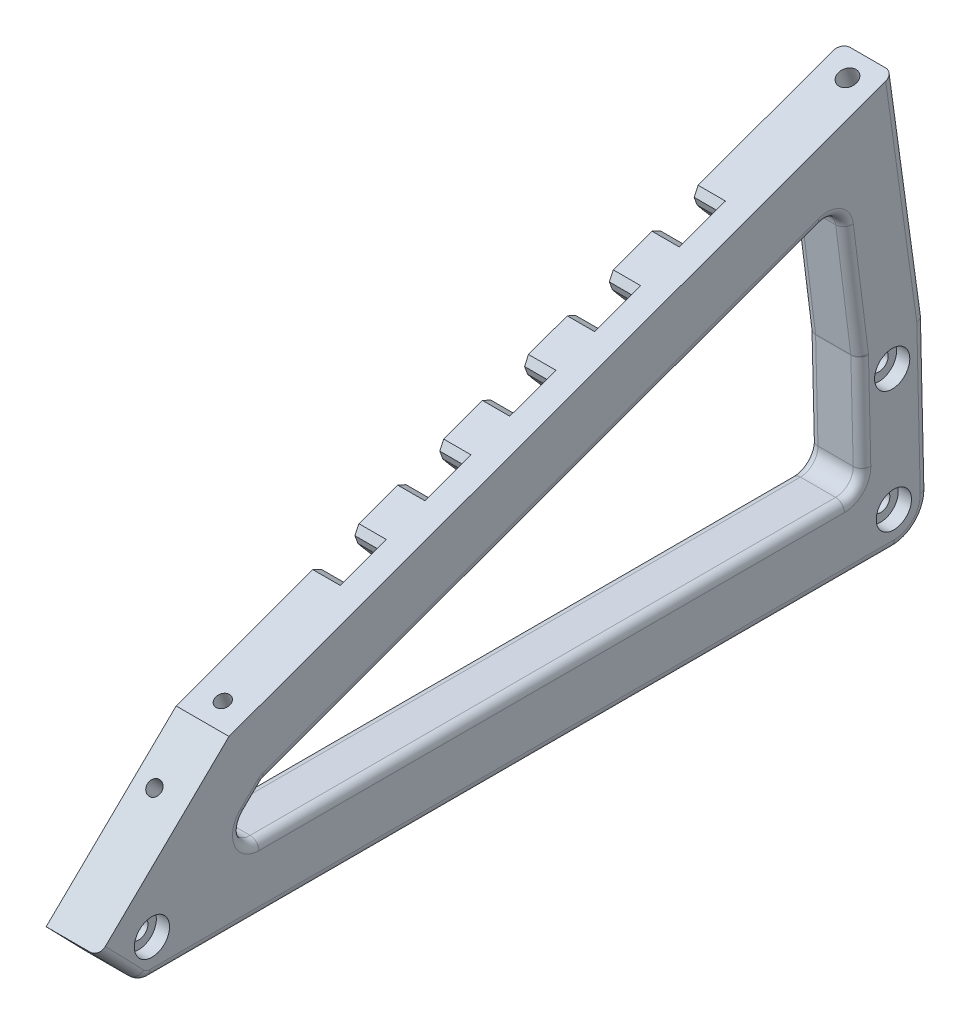
from build123d import *

# Parameters (mm, degrees)
SKETCH1_R               = 2.1
BOSS_EXTRUDE1_DEPTH     = 12
SKETCH2_R               = 1.6
SKETCH2_R_2             = 1.4
CUT_EXTRUDE1_DEPTH      = 12
SKETCH3_R               = 4
CUT_EXTRUDE2_DEPTH      = 3
SKETCH4_R               = 1.6
CUT_EXTRUDE4_DEPTH      = 19
SKETCH7_W               = 6.215759277
SKETCH7_H               = 8.138549633
CUT_EXTRUDE5_DEPTH      = 3.5
LPATTERN1_COUNT         = 5
LPATTERN1_PITCH         = 20.5
CHAMFER2_SIZE           = 1.5
FILLET1_R               = 2
FILLET2_R               = 2
SKETCH18_R              = 5.3
CUT_EXTRUDE10_DEPTH     = 1
CUT_EXTRUDE7_DEPTH      = 6
CUT_EXTRUDE7_DEPTH_BACK = 3
SKETCH13_R              = 3.1
CUT_EXTRUDE8_DEPTH      = 9
CUT_EXTRUDE8_DRAFT      = -1.5
SKETCH15_R              = 2.05
CUT_EXTRUDE9_DEPTH      = 5


with BuildPart() as part:
    # Sketch1 → Boss-Extrude1 (new body)
    with BuildSketch(Plane(origin=(0, 0, 0), x_dir=(0, 0, -1), z_dir=(1, 0, 0))):
        with BuildLine():
            Line((-80.764356581, 24.012047683), (70.342296986, 79.010371781))
            Line((70.342296986, 79.010371781), (77.475739843, 27.555189639))
            Line((77.475739843, 27.555189639), (78.259876122, -6.675276303))
            ThreePointArc((78.259876122, -6.675276303), (75.98323725, -12.450192398), (70.261974321, -14.858488677))
            Line((70.261974321, -14.858488677), (-98.699643506, -14.858488677))
            ThreePointArc((-98.699643506, -14.858488677), (-100.257936009, -14.542470826), (-101.570004389, -13.644350914))
            Line((-101.570004389, -13.644350914), (-110.297725107, -4.651907634))
            Line((-110.297725107, -4.651907634), (-80.764356581, 24.012047683))
        make_face()
        with Locations((-98.266405981, -6.675276303)):
            Circle(SKETCH1_R, mode=Mode.SUBTRACT)
        with Locations((70.261974321, -6.858488677)):
            Circle(SKETCH1_R, mode=Mode.SUBTRACT)
        with Locations((69.886409545, 21.014527834)):
            Circle(SKETCH1_R, mode=Mode.SUBTRACT)
        with BuildLine():
            Line((-72.418480279, 11.087031648), (53.732828795, 57.002353165))
            ThreePointArc((53.732828795, 57.002353165), (57.186228005, 56.657004159), (59.069743036, 53.741939293))
            Line((59.069743036, 53.741939293), (62.491983944, 26.487750987))
            ThreePointArc((62.491983944, 26.487750987), (62.497003485, 26.437568826), (62.499486631, 26.387197416))
            Line((62.499486631, 26.387197416), (63.032017641, 4.237653648))
            ThreePointArc((63.032017641, 4.237653648), (61.895389964, 1.347282386), (59.033173226, 0.141511323))
            Line((59.033173226, 0.141511323), (-73.956988486, 0.141511323))
            ThreePointArc((-73.956988486, 0.141511323), (-77.663836441, 2.63842176), (-76.742850722, 7.011872206))
            Line((-76.742850722, 7.011872206), (-72.772925695, 10.864929248))
            ThreePointArc((-72.772925695, 10.864929248), (-72.607445548, 10.994719988), (-72.418480279, 11.087031648))
        make_face(mode=Mode.SUBTRACT)
    extrude(amount=BOSS_EXTRUDE1_DEPTH)

    # Sketch2 → Cut-Extrude1 (cut)
    with BuildSketch(Plane(origin=(0, 47.160335546, 17.164958377), x_dir=(1, 0, 0), z_dir=(0, 0.9396926207859057, 0.3420201433256765))):
        with Locations(Location((6, -62.781065912, 0), (0, 0, 270))):
            Circle(SKETCH2_R)
        with Locations(Location((6, 88.222046544, 0), (0, 0, 270))):
            Circle(SKETCH2_R_2)
    extrude(amount=-CUT_EXTRUDE1_DEPTH, mode=Mode.SUBTRACT)

    # Sketch3 → Cut-Extrude2 (cut)
    with BuildSketch(Plane(origin=(12, 0, 0), x_dir=(0, 0, -1), z_dir=(1, 0, 0))):
        with Locations((-98.266405981, -6.675276303)):
            Circle(SKETCH3_R)
        with Locations((70.261974321, -6.858488677)):
            Circle(SKETCH3_R)
        with Locations((69.886409545, 21.014527834)):
            Circle(SKETCH3_R)
    extrude(amount=-CUT_EXTRUDE2_DEPTH, mode=Mode.SUBTRACT)

    # Sketch4 → Cut-Extrude4 (cut)
    with BuildSketch(Plane(origin=(0, 52.72881887, 51.176570214), x_dir=(1, 0, 0), z_dir=(0, 0.7175902207560236, 0.6964655591451175))):
        with Locations(Location((4.5, -54.38846236, 0), (0, 0, 270))):
            Circle(SKETCH4_R)
    extrude(amount=-CUT_EXTRUDE4_DEPTH, mode=Mode.SUBTRACT)

    # Sketch7 → Cut-Extrude5 (cut)
    with BuildSketch(Plane(origin=(0, 47.160335546, 17.164958377), x_dir=(1, 0, 0), z_dir=(0, 0.9396926207859057, 0.34202014332567654))):
        with Locations((3.107879639, -29.077947848)):
            Rectangle(SKETCH7_W, SKETCH7_H)
        with Locations((3.107879639, -8.577947848)):
            Rectangle(SKETCH7_W, SKETCH7_H)
        with Locations((3.107879639, 11.922052153)):
            Rectangle(SKETCH7_W, SKETCH7_H)
        with Locations((3.107879639, 32.422052153)):
            Rectangle(SKETCH7_W, SKETCH7_H)
        with Locations((3.107879639, 52.922052153)):
            Rectangle(SKETCH7_W, SKETCH7_H)
    extrude(amount=-CUT_EXTRUDE5_DEPTH, mode=Mode.SUBTRACT)

    # Cut-Loft3: read off the stored shape, not the designer's step
    # Cut-Loft3: loft between two sections, ruled curve by curve
    cut_loft3_from = [
        Edge.make_bspline([(-2.232092873, 55.508495798, -43.78088061), (-2.544400917, 55.590075483, -44.005018953), (-2.880117448, 55.633872158, -44.12534933), (-3.552323761, 55.633872158, -44.12534933), (-3.888040292, 55.590075483, -44.005018953), (-4.200348336, 55.508495798, -43.78088061)], [0, 0, 0, 0, 0.5, 0.5, 1, 1, 1, 1], 3),
        Edge.make_bspline([(-2.232092873, 50.531412034, -30.106455355), (-1.989168835, 50.594867545, -30.280797939), (-1.73353162, 50.687517245, -30.535350896), (-1.227030386, 50.951449132, -31.260497796), (-0.976304902, 51.123342888, -31.732772011), (-0.532384155, 51.552515043, -32.911912816), (-0.340189811, 51.81022676, -33.619969937), (-0.073355372, 52.385448659, -35.200379116), (0, 52.702373125, -36.071121931), (0, 53.337534707, -37.816214034), (-0.073355372, 53.654459173, -38.686956849), (-0.340189811, 54.229681072, -40.267366028), (-0.532384155, 54.487392788, -40.975423149), (-0.976304902, 54.916564943, -42.154563954), (-1.227030386, 55.0884587, -42.626838169), (-1.73353162, 55.352390587, -43.351985069), (-1.989168835, 55.445040286, -43.606538025), (-2.232092873, 55.508495798, -43.78088061)], [0, 0, 0, 0, 0.125, 0.125, 0.25, 0.25, 0.375, 0.375, 0.5, 0.5, 0.625, 0.625, 0.75, 0.75, 0.875, 0.875, 1, 1, 1, 1], 3),
        Edge.make_bspline([(-4.200348336, 50.531412034, -30.106455355), (-3.888040292, 50.449832349, -29.882317012), (-3.552323761, 50.406035673, -29.761986635), (-2.880117448, 50.406035673, -29.761986635), (-2.544400917, 50.449832349, -29.882317012), (-2.232092873, 50.531412034, -30.106455355)], [0, 0, 0, 0, 0.5, 0.5, 1, 1, 1, 1], 3),
        Edge.make_line((-4.200348336, 50.531412034, -30.106455355), (-4.200348336, 55.508495798, -43.78088061)),
    ]
    cut_loft3_to = [
        Edge.make_bspline([(6.215759277, 63.363593192, -37.586441526), (5.179799398, 63.363593192, -37.586441526), (4.143839518, 63.363593192, -37.586441526), (2.071919759, 63.363593192, -37.586441526), (1.03595988, 63.363593192, -37.586441526), (0, 63.363593192, -37.586441526)], [0, 0, 0, 0, 0.5, 0.5, 1, 1, 1, 1], 3),
        Edge.make_bspline([(6.215759277, 60.58004528, -29.938706492), (6.215759277, 60.696026443, -30.257362119), (6.215759277, 60.812007606, -30.576017745), (6.215759277, 61.043969932, -31.213328998), (6.215759277, 61.159951095, -31.531984624), (6.215759277, 61.391913421, -32.169295877), (6.215759277, 61.507894584, -32.487951504), (6.215759277, 61.73985691, -33.125262756), (6.215759277, 61.855838073, -33.443918383), (6.215759277, 62.087800399, -34.081229636), (6.215759277, 62.203781562, -34.399885262), (6.215759277, 62.435743888, -35.037196515), (6.215759277, 62.551725051, -35.355852141), (6.215759277, 62.783687377, -35.993163394), (6.215759277, 62.89966854, -36.31181902), (6.215759277, 63.131630866, -36.949130273), (6.215759277, 63.247612029, -37.2677859), (6.215759277, 63.363593192, -37.586441526)], [0, 0, 0, 0, 0.125, 0.125, 0.25, 0.25, 0.375, 0.375, 0.5, 0.5, 0.625, 0.625, 0.75, 0.75, 0.875, 0.875, 1, 1, 1, 1], 3),
        Edge.make_bspline([(0, 60.58004528, -29.938706492), (1.03595988, 60.58004528, -29.938706492), (2.071919759, 60.58004528, -29.938706492), (4.143839518, 60.58004528, -29.938706492), (5.179799398, 60.58004528, -29.938706492), (6.215759277, 60.58004528, -29.938706492)], [0, 0, 0, 0, 0.5, 0.5, 1, 1, 1, 1], 3),
        Edge.make_line((0, 60.58004528, -29.938706492), (0, 63.363593192, -37.586441526)),
    ]
    cut_loft3 = Solid(Shell([*[Face.make_surface_from_curves(cut_loft3_from[k], cut_loft3_to[k]) for k in range(4)], Face(Wire(cut_loft3_from)), Face(Wire(cut_loft3_to))]))
    add(cut_loft3, mode=Mode.SUBTRACT)

    # LPattern1: Cut-Loft3 ×5
    with Locations(*[Vector(0, -0.34202014332567654, 0.9396926207859057) * (i * LPATTERN1_PITCH) for i in range(1, LPATTERN1_COUNT)]):
        add(cut_loft3, mode=Mode.SUBTRACT)

    # Chamfer2
    chamfer2_edges = [part.edges().sort_by_distance(p)[0] for p in [
        (3.107879639, 38.606865612, 40.66542388),
        (3.107879639, 35.8233177, 48.313158914),
        (3.107879639, 45.61827855, 21.401725154),
        (3.107879639, 42.834730638, 29.049460188),
        (3.107879639, 52.629691488, 2.138026428),
        (3.107879639, 49.846143576, 9.785761462),
        (3.107879639, 59.641104426, -17.125672298),
        (3.107879639, 56.857556514, -9.477937265),
        (3.107879639, 66.652517364, -36.389371024),
        (3.107879639, 63.868969453, -28.741635991),
    ]]
    chamfer(chamfer2_edges, length=CHAMFER2_SIZE)

    # Fillet1
    fillet1_edges = [part.edges().sort_by_distance(p)[0] for p in [
        (12, 10.994719988, 72.607445548),
        (12, 34.044692407, 9.342825742),
        (12, -12.450192398, -75.98323725),
        (12, 10.439956668, -77.867807983),
        (0, 34.044692407, 9.342825742),
        (0, 10.994719988, 72.607445548),
        (12, 53.28278071, -73.909018415),
        (0, 8.938400727, 74.757888209),
        (0, 2.63842176, 77.663836441),
        (0, 0.141511323, 7.46190763),
        (0, 1.347282386, -61.895389964),
        (0, 15.312425532, -62.765752136),
        (0, 26.437568826, -62.497003485),
        (0, 40.11484514, -60.78086349),
        (0, 56.657004159, -57.186228005),
        (12, -9.148129274, 105.933864748),
        (12, -14.542470826, 100.257936009),
        (12, -14.858488677, 14.218834592),
        (12, 56.657004159, -57.186228005),
        (12, 40.11484514, -60.78086349),
        (12, 26.437568826, -62.497003485),
        (12, 15.312425532, -62.765752136),
        (12, 1.347282386, -61.895389964),
        (12, 0.141511323, 7.46190763),
        (12, 2.63842176, 77.663836441),
        (12, 8.938400727, 74.757888209),
    ]]
    fillet(fillet1_edges, radius=FILLET1_R - 0.0001)  # a hair under: the kernel refuses the full size

    # Fillet2
    # the kernel refuses this fillet: 2 mm, written as the material it takes off along each edge
    with BuildSketch(Plane(origin=(0, -6.858488677, -70.261974321), x_dir=(0, 0.02290154687134815, -0.9997377251814095), z_dir=(0, 0.9997377251814095, 0.02290154687134815))) as fillet2_piece_1:
        with BuildLine():
            CenterArc((8 - FILLET2_R, -FILLET2_R), FILLET2_R, 0, 90)
            Line((8, -FILLET2_R), (8, 0))
            Line((8, 0), (8 - FILLET2_R, 0))
        make_face()
    revolve(axis=Axis((0, -6.858488677, -70.261974321), (-1, 0, 0)), revolution_arc=91.312276708, mode=Mode.SUBTRACT)
    with BuildSketch(Plane(origin=(0, 52.548632768, -76.903201171), x_dir=(0, -0.022901546871347135, 0.9997377251814095), z_dir=(0, -0.9997377251814096, -0.022901546871347135))) as fillet2_piece_2:
        with BuildLine():
            CenterArc((FILLET2_R, -FILLET2_R), FILLET2_R, 90, 90)
            Line((0, -FILLET2_R), (0, 0))
            Line((0, 0), (FILLET2_R, 0))
        make_face()
    extrude(amount=59.239446086, mode=Mode.SUBTRACT)
    with BuildSketch(Plane(origin=(0, 83.963004936, -69.655693147), x_dir=(1, 0, 0), z_dir=(0, -0.9905266310012473, -0.13732076782962976))) as fillet2_piece_3:
        with BuildLine():
            CenterArc((FILLET2_R, FILLET2_R), FILLET2_R, 180, 90)
            Line((0, FILLET2_R), (0, 0))
            Line((0, 0), (FILLET2_R, 0))
        make_face()
    extrude(amount=81.947298065, mode=Mode.SUBTRACT)
    with BuildSketch(Plane(origin=(0, -14.858488677, -70.261974321), x_dir=(0, 1, 0), z_dir=(0, 0, 1))) as fillet2_piece_4:
        with BuildLine():
            CenterArc((FILLET2_R, -FILLET2_R), FILLET2_R, 90, 90)
            Line((0, -FILLET2_R), (0, 0))
            Line((0, 0), (FILLET2_R, 0))
        make_face()
    extrude(amount=173.961617827, mode=Mode.SUBTRACT)

    # Sketch18 → Cut-Extrude10 (cut)
    with BuildSketch(Plane.XZ.offset(14.858488677)):
        with Locations(Location((6, -45.261974321, 0), (0, 0, 270))):
            Circle(SKETCH18_R)
        with Locations(Location((6, 73.699643506, 0), (0, 0, 270))):
            Circle(SKETCH18_R)
    extrude(amount=-CUT_EXTRUDE10_DEPTH, mode=Mode.SUBTRACT)

    # Sketch13 → Cut-Extrude7 (cut, two sides: drawn at the far end of the back side and taken through both)
    with BuildSketch(Plane(origin=(0, 34.944331476, 12.718696514), x_dir=(1, 0, 0), z_dir=(0, -0.9396926207859057, -0.3420201433256765)).offset(-CUT_EXTRUDE7_DEPTH_BACK)):
        with Locations(Location((6, 62.781065912, 0), (0, 0, 37.498375502))):
            Circle(SKETCH13_R)
    extrude(amount=CUT_EXTRUDE7_DEPTH + CUT_EXTRUDE7_DEPTH_BACK, mode=Mode.SUBTRACT)


with BuildPart() as cut_extrude8_tool:
    # Sketch14 → Cut-Extrude8 (with draft: the straight prism first)
    with BuildSketch(Plane(origin=(0, 39.094604676, 37.94372459), x_dir=(1, 0, 0), z_dir=(0, -0.7175902207560237, -0.6964655591451177))):
        Polygon((1.525538746, 52.612911672), (4.550441375, 50.924728007), (7.524902629, 52.700278695), (7.474461254, 56.164013048), (4.449558625, 57.852196713), (1.475097371, 56.076646025), align=None)
    extrude(amount=-CUT_EXTRUDE8_DEPTH)
    # Cut-Extrude8: the draft: its side faces are tilted about the plane it starts from
    cut_extrude8_sides = [cut_extrude8_tool.faces().sort_by_distance(p)[0] for p in [
        (3.03799006, 6.268560614, 78.226618463),
        (6.037672002, 6.238136552, 78.257965324),
        (7.499681942, 4.413645759, 80.137795179),
        (5.96200994, 2.619579028, 81.986278173),
        (2.962327998, 2.650003089, 81.954931312),
        (1.500318058, 4.474493882, 80.075101457),
    ]]
    draft(cut_extrude8_sides, Plane(origin=(0, 39.094604676, 37.94372459), x_dir=(1, 0, 0), z_dir=(0, -0.7175902207560237, -0.6964655591451177)), CUT_EXTRUDE8_DRAFT)


with BuildPart() as part_1:
    add(part.part)

    # Cut-Extrude8: cut by cut_extrude8_tool
    add(cut_extrude8_tool.part, mode=Mode.SUBTRACT)

    # Sketch15 → Cut-Extrude9 (cut)
    with BuildSketch(Plane(origin=(0, 47.160335546, 17.164958377), x_dir=(1, 0, 0), z_dir=(0, 0.9396926207859057, 0.34202014332567654))):
        with Locations(Location((6, 88.222046544, 0), (0, 0, 270))):
            Circle(SKETCH15_R)
    extrude(amount=-CUT_EXTRUDE9_DEPTH, mode=Mode.SUBTRACT)


solid = part_1.part
